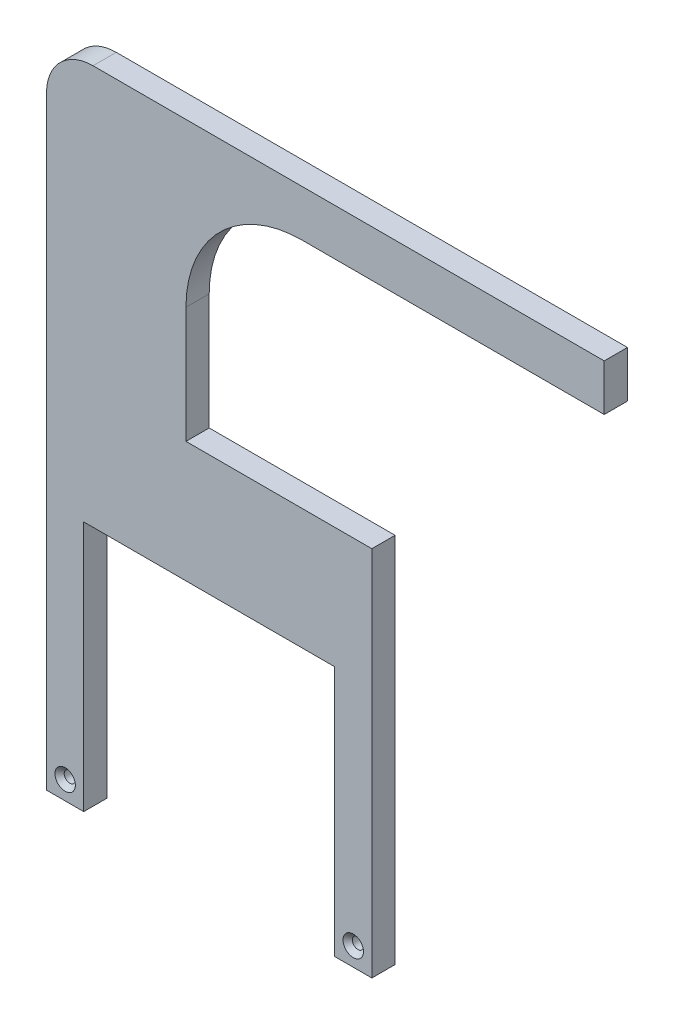
from build123d import *

# Parameters (mm, degrees)
BOSS_EXTRU_1_DEPTH                             = 5
FRAISAGE_POUR_VIS_T_TE_FRAIS_E_M21_D           = 2.4
FRAISAGE_POUR_VIS_T_TE_FRAIS_E_M21_CSINK_D     = 4.4
FRAISAGE_POUR_VIS_T_TE_FRAIS_E_M21_CSINK_ANGLE = 90
CONG_1_R                                       = 10
CONG_2_R                                       = 25


with BuildPart() as part:
    # Esquisse1 → Boss.-Extru.1 (new body)
    with BuildSketch(Plane.XY):
        Polygon((0, 0), (0, 140), (120, 140), (120, 130), (30, 130), (30, 80), (70, 80), (70, 0), (62, 0), (62, 54), (8, 54), (8, 0), align=None)
    extrude(amount=BOSS_EXTRU_1_DEPTH)

    # Fraisage pour vis à tête fraisée M21 (through all)
    with Locations(Plane.XY.offset(5)):
        with Locations((4, 4), (66, 4)):
            CounterSinkHole(FRAISAGE_POUR_VIS_T_TE_FRAIS_E_M21_D / 2, FRAISAGE_POUR_VIS_T_TE_FRAIS_E_M21_CSINK_D / 2, counter_sink_angle=FRAISAGE_POUR_VIS_T_TE_FRAIS_E_M21_CSINK_ANGLE)

    # Congé1
    cong_1_edges = [part.edges().sort_by_distance(p)[0] for p in [
        (0, 140, 2.5),
    ]]
    fillet(cong_1_edges, radius=CONG_1_R)

    # Congé2
    cong_2_edges = [part.edges().sort_by_distance(p)[0] for p in [
        (30, 130, 2.5),
    ]]
    fillet(cong_2_edges, radius=CONG_2_R)


solid = part.part
